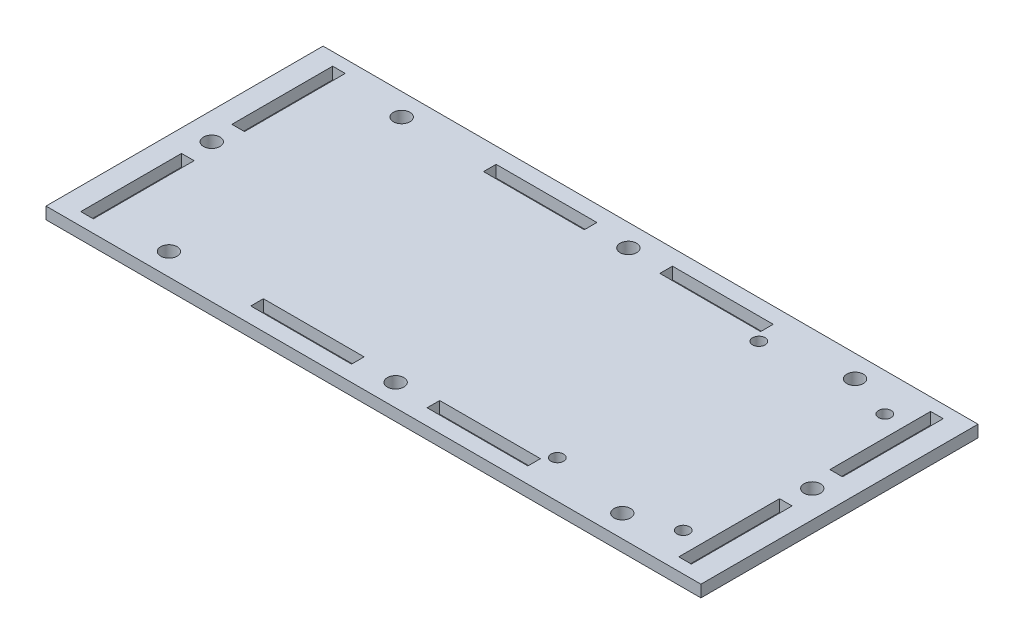
from build123d import *

# Parameters (mm, degrees)
SKETCH1_W           = 165.1
SKETCH1_H           = 69.85
BOSS_EXTRUDE1_DEPTH = 3
SKETCH3_R           = 2.0828
CUT_EXTRUDE2_DEPTH  = 5.08
SKETCH5_R           = 1.5875
CUT_EXTRUDE4_DEPTH  = 7.874
SKETCH6_W           = 25.4
SKETCH6_H           = 3.175
SKETCH6_W_2         = 3.175
SKETCH6_H_2         = 25.4
CUT_EXTRUDE5_DEPTH  = 10.922


with BuildPart() as part:
    # Sketch1 → Boss-Extrude1 (new body)
    with BuildSketch(Plane(origin=(0, 0, 0), x_dir=(1, 0, 0), z_dir=(0, 1, 0))):
        Rectangle(SKETCH1_W, SKETCH1_H)
    extrude(amount=BOSS_EXTRUDE1_DEPTH)

    # Sketch3 → Cut-Extrude2 (cut)
    with BuildSketch(Plane(origin=(0, 3, 0), x_dir=(1, 0, 0), z_dir=(0, 1, 0))):
        with Locations((-75.692, 0)):
            Circle(SKETCH3_R)
        with Locations((75.692, 0)):
            Circle(SKETCH3_R)
        with Locations((0, -29.337)):
            Circle(SKETCH3_R)
        with Locations((0, 29.337)):
            Circle(SKETCH3_R)
        with Locations((57.15, 29.337)):
            Circle(SKETCH3_R)
        with Locations((57.15, -29.337)):
            Circle(SKETCH3_R)
        with Locations((-57.15, -29.337)):
            Circle(SKETCH3_R)
        with Locations((-57.15, 29.337)):
            Circle(SKETCH3_R)
    extrude(amount=-CUT_EXTRUDE2_DEPTH, mode=Mode.SUBTRACT)

    # Sketch5 → Cut-Extrude4 (cut)
    with BuildSketch(Plane(origin=(0, 3, 0), x_dir=(1, 0, 0), z_dir=(0, 1, 0))):
        with Locations((68.58, -25.4)):
            Circle(SKETCH5_R)
        with Locations((68.58, 25.4)):
            Circle(SKETCH5_R)
        with Locations((36.83, 25.4)):
            Circle(SKETCH5_R)
        with Locations((36.83, -25.4)):
            Circle(SKETCH5_R)
    extrude(amount=-CUT_EXTRUDE4_DEPTH, mode=Mode.SUBTRACT)

    # Sketch6 → Cut-Extrude5 (cut)
    with BuildSketch(Plane(origin=(0, 3, 0), x_dir=(1, 0, 0), z_dir=(0, 1, 0))):
        with Locations((-22.225, 29.337)):
            Rectangle(SKETCH6_W, SKETCH6_H)
        with Locations((22.225, 29.337)):
            Rectangle(SKETCH6_W, SKETCH6_H)
        with Locations((-22.225, -29.337)):
            Rectangle(SKETCH6_W, SKETCH6_H)
        with Locations((22.225, -29.337)):
            Rectangle(SKETCH6_W, SKETCH6_H)
        with Locations((-75.3745, 19.05)):
            Rectangle(SKETCH6_W_2, SKETCH6_H_2)
        with Locations((-75.3745, -19.05)):
            Rectangle(SKETCH6_W_2, SKETCH6_H_2)
        with Locations((75.3745, -19.05)):
            Rectangle(SKETCH6_W_2, SKETCH6_H_2)
        with Locations((75.3745, 19.05)):
            Rectangle(SKETCH6_W_2, SKETCH6_H_2)
    extrude(amount=-CUT_EXTRUDE5_DEPTH, mode=Mode.SUBTRACT)


solid = part.part
